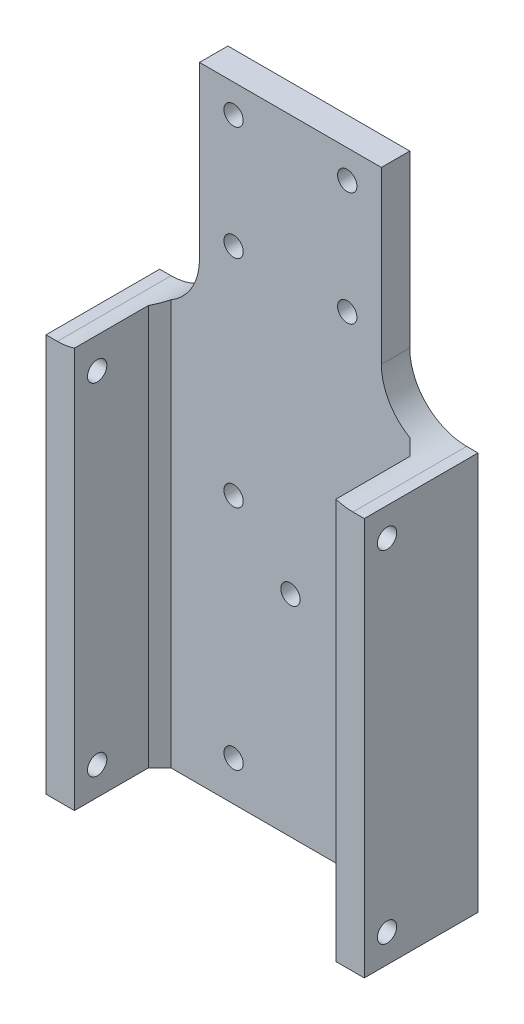
from build123d import *

# Parameters (mm, degrees)
SKETCH1_W            = 32
SKETCH1_H            = 5
BOSS_EXTRUDE1_DEPTH  = 40
M3_CLEARANCE_HOLE3_D = 3.4
SKETCH4_W            = 46
SKETCH4_H            = 5
BOSS_EXTRUDE2_DEPTH  = 70
SKETCH5_W            = 5
SKETCH5_H            = 20
BOSS_EXTRUDE3_DEPTH  = 70
M3_CLEARANCE_HOLE1_D = 3.4
M3_CLEARANCE_HOLE2_D = 3.4
FILLET2_R            = 10
FILLET4_SIZE         = 2


with BuildPart() as part:
    # Sketch1 → Boss-Extrude1 (new body)
    with BuildSketch(Plane(origin=(0, 0, 0), x_dir=(1, 0, 0), z_dir=(0, 1, 0))):
        Rectangle(SKETCH1_W, SKETCH1_H)
    extrude(amount=BOSS_EXTRUDE1_DEPTH)

    # M3 Clearance Hole3 (through all)
    with Locations(Plane.XY.offset(2.5)):
        with Locations((-10, 35), (10, 35), (10, 15), (-10, 15)):
            Hole(M3_CLEARANCE_HOLE3_D / 2)

    # Sketch4 → Boss-Extrude2 (add)
    with BuildSketch(Plane(origin=(0, 0, 0), x_dir=(1, 0, 0), z_dir=(0, 1, 0))):
        Rectangle(SKETCH4_W, SKETCH4_H)
    extrude(amount=-BOSS_EXTRUDE2_DEPTH)

    # Sketch5 → Boss-Extrude3 (add)
    with BuildSketch(Plane(origin=(0, 0, 0), x_dir=(1, 0, 0), z_dir=(0, 1, 0))):
        with Locations((25.5, -7.5)):
            Rectangle(SKETCH5_W, SKETCH5_H)
        with Locations((-25.5, -7.5)):
            Rectangle(SKETCH5_W, SKETCH5_H)
    extrude(amount=-BOSS_EXTRUDE3_DEPTH)

    # M3 Clearance Hole1 (through all)
    with Locations(Plane(origin=(28, 0, 0), x_dir=(0, 0, -1), z_dir=(1, 0, 0))):
        with Locations((-13.5, -5), (-13.5, -65)):
            Hole(M3_CLEARANCE_HOLE1_D / 2)

    # M3 Clearance Hole2 (through all)
    with Locations(Plane(origin=(0, 0, -2.5), x_dir=(-1, 0, 0), z_dir=(0, 0, -1))):
        with Locations((-10, -23), (10, -23), (0, -33), (-10, -63), (10, -63)):
            Hole(M3_CLEARANCE_HOLE2_D / 2)

    # Fillet2
    fillet2_edges = [part.edges().sort_by_distance(p)[0] for p in [
        (-16, 0, 0),
        (16, 0, 0),
    ]]
    fillet(fillet2_edges, radius=FILLET2_R)

    # Fillet4
    fillet4_edges = [part.edges().sort_by_distance(p)[0] for p in [
        (23, -34.769696007, 2.5),
        (-23, -34.769696007, 2.5),
    ]]
    chamfer(fillet4_edges, length=FILLET4_SIZE)


solid = part.part
